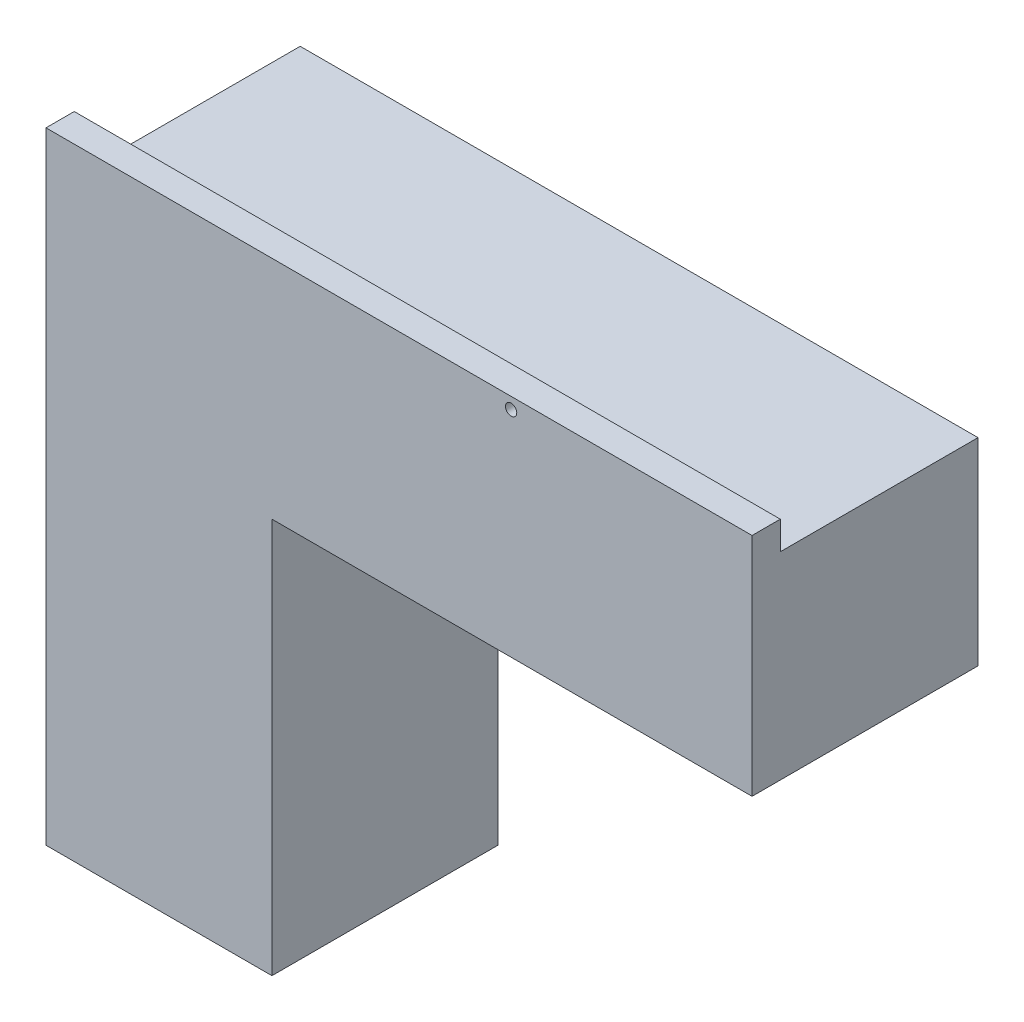
from build123d import *

# Parameters (mm, degrees)
EXTRUDE_1_DEPTH     = 80
SKETCH_2_W          = 10
SKETCH_2_H          = 70
CUT_EXTRUDE_1_DEPTH = 250
SKETCH_3_W          = 70
SKETCH_3_H          = 10
CUT_EXTRUDE_2_DEPTH = 250
SKETCH_4_R          = 2
CUT_EXTRUDE_3_DEPTH = 10


with BuildPart() as part:
    # Эскиз1 → Бобышка-Вытянуть1 (new body)
    with BuildSketch(Plane.XY):
        Polygon((0, 0), (0, 220), (250, 220), (250, 140), (80, 140), (80, 0), align=None)
    extrude(amount=EXTRUDE_1_DEPTH)

    # Эскиз2 → Вырез-Вытянуть1 (cut)
    with BuildSketch(Plane.XZ):
        with Locations((5, 35)):
            Rectangle(SKETCH_2_W, SKETCH_2_H)
    extrude(amount=-CUT_EXTRUDE_1_DEPTH, mode=Mode.SUBTRACT)

    # Эскиз3 → Вырез-Вытянуть2 (cut)
    with BuildSketch(Plane(origin=(250, 0, 0), x_dir=(0, 0, -1), z_dir=(1, 0, 0))):
        with Locations((-35, 215)):
            Rectangle(SKETCH_3_W, SKETCH_3_H)
    extrude(amount=-CUT_EXTRUDE_2_DEPTH, mode=Mode.SUBTRACT)

    # Эскиз4 → Вырез-Вытянуть3 (cut)
    with BuildSketch(Plane.XY.offset(80)):
        with Locations((164.688168886, 215.921532847)):
            Circle(SKETCH_4_R)
    extrude(amount=-CUT_EXTRUDE_3_DEPTH, mode=Mode.SUBTRACT)


solid = part.part
